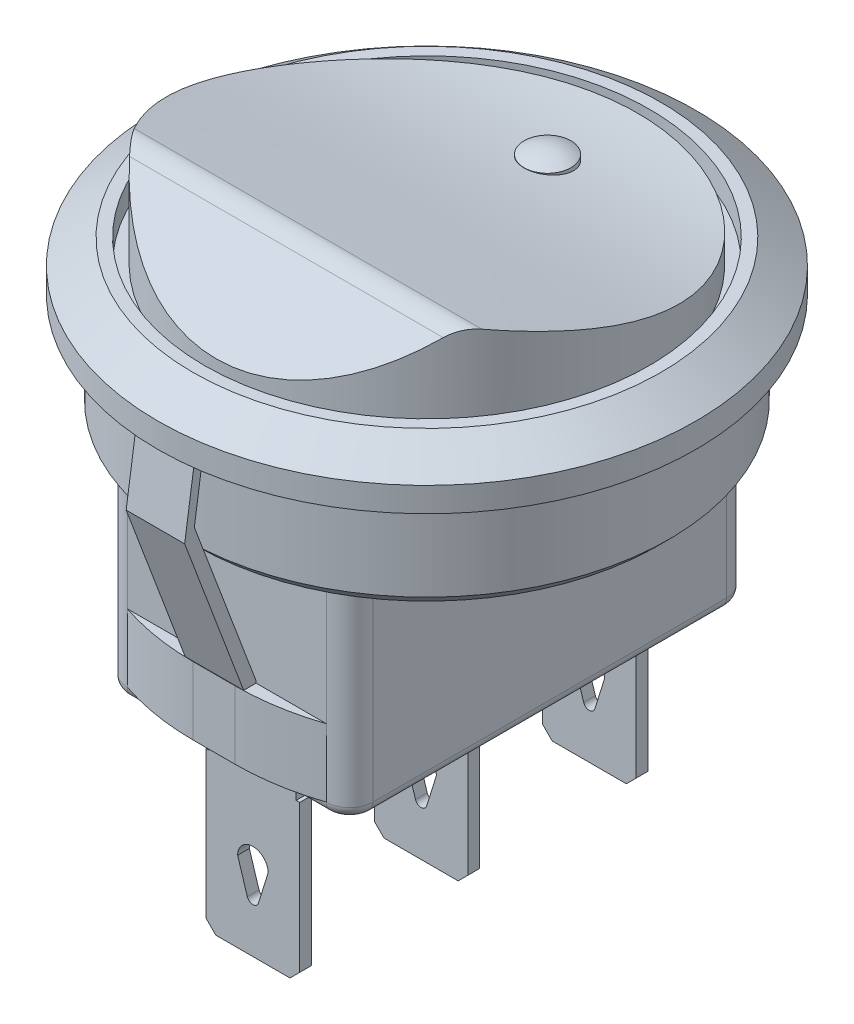
from build123d import *

# Parameters (mm, degrees)
CUT_EXTRUDE1_DEPTH       = 10
CUT_EXTRUDE1_DEPTH_BACK  = 10
SKETCH4_R                = 9.5
SKETCH4_R_2              = 9
CUT_EXTRUDE2_DEPTH       = 1
BOSS_EXTRUDE1_DEPTH      = 5.25
BOSS_EXTRUDE1_DEPTH_BACK = 5.25
SKETCH5_W                = 17.1
SKETCH5_H                = 8.5
FILLET1_R                = 1
FILLET2_R                = 0.5
BOSS_EXTRUDE2_DEPTH      = 2
BOSS_EXTRUDE2_DEPTH_BACK = 2
CUT_EXTRUDE4_REACH       = 33.935
SKETCH7_W                = 0.15198881
SKETCH7_H                = 0.437250331
SKETCH8_R                = 1
BOSS_EXTRUDE4_DEPTH      = 0.5
DOME1_FACE_RADIUS        = 1
DOME1_HEIGHT             = 0.25
BOSS_EXTRUDE5_DEPTH      = 1.25
SKETCH11_W               = 8.5
SKETCH11_H               = 2.901212209
BOSS_EXTRUDE6_DEPTH      = 0.55
FILLET3_R                = 10.5
MIRROR2_START            = -14.5
MIRROR2_DEPTH            = 2.901212209


# Read off the part's stored shape, not the designer's step: Mirror2
with BuildPart() as part:
    # Sketch1 → Revolve1 (revolve)
    with BuildSketch(Plane(origin=(0, 0, 0), x_dir=(0, 0, -1), z_dir=(1, 0, 0))):
        Polygon((0, -6.5), (-9.85, -6.5), (-10.35, -6), (-10.35, -2.1), (-11.5, -2.1), (-11.5, -1.05), (-10, 0), (-9, 0), (-9, 3), (0, 3), (0, 0), align=None)
    revolve(axis=Axis((0, 0, 0), (0, -1, 0)))

    # Sketch3 → Cut-Extrude1 (cut, two sides: drawn at the far end of the back side and taken through both)
    with BuildSketch(Plane(origin=(0, 0, 0), x_dir=(0, 0, -1), z_dir=(1, 0, 0)).offset(-CUT_EXTRUDE1_DEPTH_BACK)):
        with BuildLine():
            Line((-9, 0), (-6.004871006, 2.642395133))
            ThreePointArc((-6.004871006, 2.642395133), (-5.571055004, 2.86623052), (-5.082965507, 2.858030108))
            add(Edge.make_bspline(
                [(9, 0.1), (3.500957761, 0.065162529), (-0.63708622, 1.659275419), (-5.082965507, 2.858030108)],
                knots=[0, 0, 0, 0, 0.851151632, 0.851151632, 0.851151632, 0.851151632], degree=3))
            Line((9, 0.1), (9, 3))
            Line((9, 3), (-9, 3))
            Line((-9, 3), (-9, 0))
        make_face()
    extrude(amount=CUT_EXTRUDE1_DEPTH + CUT_EXTRUDE1_DEPTH_BACK, mode=Mode.SUBTRACT)

    # Sketch4 → Cut-Extrude2 (cut)
    with BuildSketch(Plane(origin=(0, 0, 0), x_dir=(1, 0, 0), z_dir=(0, 1, 0))):
        with Locations(Location((0, 0, 0), (0, 0, 270))):
            Circle(SKETCH4_R)
        with Locations(Location((0, 0, 0), (0, 0, 270))):
            Circle(SKETCH4_R_2, mode=Mode.SUBTRACT)
    extrude(amount=-CUT_EXTRUDE2_DEPTH, mode=Mode.SUBTRACT)

    # Sketch5 → Boss-Extrude1 (add, two sides: drawn at the far end of the back side and taken through both)
    with BuildSketch(Plane(origin=(0, 0, 0), x_dir=(0, 0, -1), z_dir=(1, 0, 0)).offset(-BOSS_EXTRUDE1_DEPTH_BACK)):
        with Locations((0, -10.75)):
            Rectangle(SKETCH5_W, SKETCH5_H)
    extrude(amount=BOSS_EXTRUDE1_DEPTH + BOSS_EXTRUDE1_DEPTH_BACK)

    # Fillet1
    # the kernel refuses this fillet: 1 mm, written as the material it takes off along each edge
    with BuildSketch(Plane(origin=(-5.25, -17.5, 8.55), x_dir=(1, 0, 0), z_dir=(0, 1, 0)), Plane(origin=(5.25, -6.5, -8.55), x_dir=(0, 0, 1), z_dir=(0, -1, 0))) as fillet1_piece_1:
        with BuildLine():
            CenterArc((FILLET1_R, FILLET1_R), FILLET1_R, 180, 90)
            Line((0, FILLET1_R), (0, 0))
            Line((0, 0), (FILLET1_R, 0))
        make_face()
    extrude(amount=11, mode=Mode.SUBTRACT)
    with BuildSketch(Plane(origin=(-5.25, -6.5, -8.55), x_dir=(0, 0, 1), z_dir=(0, -1, 0)), Plane(origin=(5.25, -17.5, 8.55), x_dir=(-1, 0, 0), z_dir=(0, 1, 0))) as fillet1_piece_2:
        with BuildLine():
            CenterArc((FILLET1_R, -FILLET1_R), FILLET1_R, 90, 90)
            Line((0, -FILLET1_R), (0, 0))
            Line((0, 0), (FILLET1_R, 0))
        make_face()
    extrude(amount=11, mode=Mode.SUBTRACT)

    # Fillet2
    fillet2_edges = [part.edges().sort_by_distance(p)[0] for p in [
        (0, -15, 8.55),
        (0, -15, -8.55),
        (5.25, -15, 0),
        (-5.25, -15, 0),
        (4.957106781, -15, 8.257106781),
        (4.957106781, -15, -8.257106781),
        (-4.957106781, -15, -8.257106781),
        (-4.957106781, -15, 8.257106781),
    ]]
    fillet(fillet2_edges, radius=FILLET2_R)

    # Sketch6 → Boss-Extrude2 (add, two sides: drawn at the far end of the back side and taken through both)
    with BuildSketch(Plane(origin=(0, 0, 0), x_dir=(0, 0, -1), z_dir=(1, 0, 0)).offset(-BOSS_EXTRUDE2_DEPTH_BACK)):
        Polygon((0.25, -15), (-0.25, -15), (-0.25, -22.9), (-0.15, -23), (0.15, -23), (0.25, -22.9), align=None)
        Polygon((-7.337194576, -23), (-7.037194576, -23), (-6.937194576, -22.9), (-6.937194576, -15), (-7.437194576, -15), (-7.437194576, -22.9), align=None)
        Polygon((7.437194576, -22.9), (7.337194576, -23), (7.037194576, -23), (6.937194576, -22.9), (6.937194576, -15), (7.437194576, -15), align=None)
    extrude(amount=BOSS_EXTRUDE2_DEPTH + BOSS_EXTRUDE2_DEPTH_BACK)

    # Cut-Extrude4: up to this face of the body (flat: up to its plane)
    cut_extrude4_end = Plane(part.part.faces().sort_by_distance((0, -18.95, 7.437194576))[0])
    # Sketch7 → Cut-Extrude4 (cut, up to the picked face)
    with BuildSketch(Plane(origin=(0, 0, -7.437194576), x_dir=(-1, 0, 0), z_dir=(0, 0, -1)), mode=Mode.PRIVATE) as cut_extrude4_sk1:
        Polygon((1.48452642, -23), (2, -22.48452642), (2, -23), align=None)
    cut_extrude4_tool1 = split(extrude(cut_extrude4_sk1.sketch, amount=-CUT_EXTRUDE4_REACH, mode=Mode.PRIVATE), bisect_by=cut_extrude4_end, keep=Keep.BOTH, mode=Mode.PRIVATE)
    # Sketch7 → Cut-Extrude4 (cut, up to the picked face)
    with BuildSketch(Plane(origin=(0, 0, -7.437194576), x_dir=(-1, 0, 0), z_dir=(0, 0, -1)), mode=Mode.PRIVATE) as cut_extrude4_sk2:
        with Locations((1.924005595, -15.976692476)):
            Rectangle(SKETCH7_W, SKETCH7_H)
    cut_extrude4_tool2 = split(extrude(cut_extrude4_sk2.sketch, amount=-CUT_EXTRUDE4_REACH, mode=Mode.PRIVATE), bisect_by=cut_extrude4_end, keep=Keep.BOTH, mode=Mode.PRIVATE)
    # Sketch7 → Cut-Extrude4 (cut, up to the picked face)
    with BuildSketch(Plane(origin=(0, 0, -7.437194576), x_dir=(-1, 0, 0), z_dir=(0, 0, -1)), mode=Mode.PRIVATE) as cut_extrude4_sk3:
        with Locations((-1.924005595, -15.976692476)):
            Rectangle(SKETCH7_W, SKETCH7_H)
    cut_extrude4_tool3 = split(extrude(cut_extrude4_sk3.sketch, amount=-CUT_EXTRUDE4_REACH, mode=Mode.PRIVATE), bisect_by=cut_extrude4_end, keep=Keep.BOTH, mode=Mode.PRIVATE)
    # Sketch7 → Cut-Extrude4 (cut, up to the picked face)
    with BuildSketch(Plane(origin=(0, 0, -7.437194576), x_dir=(-1, 0, 0), z_dir=(0, 0, -1)), mode=Mode.PRIVATE) as cut_extrude4_sk4:
        Polygon((-1.48452642, -23), (-2, -22.48452642), (-2, -23), align=None)
    cut_extrude4_tool4 = split(extrude(cut_extrude4_sk4.sketch, amount=-CUT_EXTRUDE4_REACH, mode=Mode.PRIVATE), bisect_by=cut_extrude4_end, keep=Keep.BOTH, mode=Mode.PRIVATE)
    # Sketch7 → Cut-Extrude4 (cut, up to the picked face)
    with BuildSketch(Plane(origin=(0, 0, -7.437194576), x_dir=(-1, 0, 0), z_dir=(0, 0, -1)), mode=Mode.PRIVATE) as cut_extrude4_sk5:
        with BuildLine():
            Line((-0.652188184, -19.474698282), (-0.238643365, -20.799500715))
            ThreePointArc((-0.238643365, -20.799500715), (0, -20.975006794), (0.238643365, -20.799500715))
            Line((0.238643365, -20.799500715), (0.652188184, -19.474698282))
            ThreePointArc((0.652188184, -19.474698282), (0, -18.822510099), (-0.652188184, -19.474698282))
        make_face()
    cut_extrude4_tool5 = split(extrude(cut_extrude4_sk5.sketch, amount=-CUT_EXTRUDE4_REACH, mode=Mode.PRIVATE), bisect_by=cut_extrude4_end, keep=Keep.BOTH, mode=Mode.PRIVATE)
    add(cut_extrude4_tool1.solids().sort_by(Axis((-1.828175, -22.828175, -7.437195), (0, 0, 1)))[0], mode=Mode.SUBTRACT)
    add(cut_extrude4_tool2.solids().sort_by(Axis((-1.924006, -15.976692, -7.437195), (0, 0, 1)))[0], mode=Mode.SUBTRACT)
    add(cut_extrude4_tool3.solids().sort_by(Axis((1.924006, -15.976692, -7.437195), (0, 0, 1)))[0], mode=Mode.SUBTRACT)
    add(cut_extrude4_tool4.solids().sort_by(Axis((1.828175, -22.828175, -7.437195), (0, 0, 1)))[0], mode=Mode.SUBTRACT)
    add(cut_extrude4_tool5.solids().sort_by(Axis((0, -19.768855, -7.437195), (0, 0, 1)))[0], mode=Mode.SUBTRACT)

    # Sketch8 → Boss-Extrude4 (add)
    with BuildSketch(Plane(origin=(0, 0, 0), x_dir=(1, 0, 0), z_dir=(0, 1, 0))):
        with Locations(Location((0, 5.153544254, 0), (0, 0, 90))):
            Circle(SKETCH8_R)
    extrude(amount=BOSS_EXTRUDE4_DEPTH)

    # Dome1: a dome of height H over a round flat face of radius A is a cap of a sphere of radius (A * A + H * H) / (2 * H)
    dome1_r = (DOME1_FACE_RADIUS * DOME1_FACE_RADIUS + DOME1_HEIGHT * DOME1_HEIGHT) / (2 * DOME1_HEIGHT)
    dome1_base = Plane((0, 0.5, -5.153544254), z_dir=(0, 1, 0))
    with Locations(dome1_base.offset(DOME1_HEIGHT - dome1_r)):
        dome1_ball = Sphere(dome1_r, mode=Mode.PRIVATE)
    add(split(dome1_ball, bisect_by=dome1_base, keep=Keep.TOP, mode=Mode.PRIVATE))

    # Sketch9 → Boss-Extrude5 (add, symmetric)
    with BuildSketch(Plane(origin=(0, 0, 0), x_dir=(0, 0, -1), z_dir=(1, 0, 0))):
        Polygon((11.189766079, -2.1), (11.603464839, -4.916902693), (8.55, -13.011373866), (8.55, -11.511373866), (11.189766079, -4.513582322), (10.835300156, -2.1), align=None)
    boss_extrude5 = extrude(amount=BOSS_EXTRUDE5_DEPTH, both=True)

    # Mirror1: Boss-Extrude5 across plane
    add(boss_extrude5.mirror(Plane.XY))

    # Sketch11 → Boss-Extrude6 (add)
    with BuildSketch(Plane(origin=(0, 0, -8.55), x_dir=(-1, 0, 0), z_dir=(0, 0, -1))):
        with Locations((0, -13.049393896)):
            Rectangle(SKETCH11_W, SKETCH11_H)
    extrude(amount=BOSS_EXTRUDE6_DEPTH)

    # Fillet3
    # the kernel refuses this fillet: 10.5 mm, written as the material it takes off along each edge
    with BuildSketch(Plane(origin=(4.25, -22.884323169, -9.1), x_dir=(-1.1142601992564705e-12, 0, 1.0), z_dir=(0, 1, 0)), Plane(origin=(-4.25, -11.598787791, -9.1), x_dir=(1.1142601992564705e-12, 0, 1.0), z_dir=(0, -1, 0))) as fillet3_piece_1:
        with BuildLine():
            CenterArc((10.5, -3.353729268), FILLET3_R, 161.37318815, 18.62681185)
            Line((0, -3.353729268), (0, 0))
            Line((0, 0), (0.55, 0))
        make_face()
    extrude(amount=11.285535378, mode=Mode.SUBTRACT)

    # Mirror2 outline → Mirror2 (add)
    with BuildSketch(Plane(origin=(0, 0, 0), x_dir=(1, 0, 0), z_dir=(0, 1, 0)).offset(MIRROR2_START)):
        with BuildLine():
            Line((-0.896270732, -9.1), (0.896270732, -9.1))
            ThreePointArc((0.896270732, -9.1), (2.595535279, -8.961587716), (4.25, -8.55))
            Line((4.25, -8.55), (-4.25, -8.55))
            ThreePointArc((-4.25, -8.55), (-2.595535279, -8.961587716), (-0.896270732, -9.1))
        make_face()
    extrude(amount=MIRROR2_DEPTH)


solid = part.part
